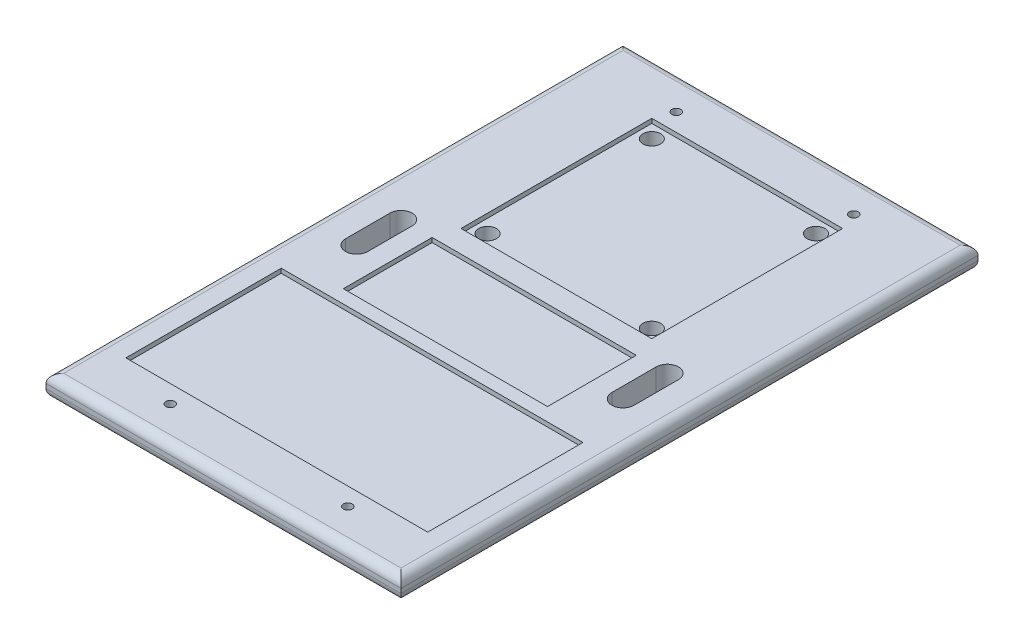
from build123d import *

# Parameters (mm, degrees)
SKETCH2_W               = 80
SKETCH2_H               = 130
BOSS_EXTRUDE1_DEPTH     = 3
SKETCH3_W               = 80
SKETCH3_H               = 130
BOSS_EXTRUDE2_DEPTH     = 2
FILLET1_R               = 2
CUT_EXTRUDE1_DEPTH      = 153.672852859
CUT_EXTRUDE1_DEPTH_BACK = 153.672852859
SKETCH6_R               = 1
CUT_EXTRUDE2_DEPTH      = 3
SKETCH6_3_W             = 68
SKETCH6_3_H             = 35
SKETCH6_3_W_2           = 43
SKETCH6_3_H_2           = 43
SKETCH6_3_R             = 2
SKETCH6_3_W_3           = 46
SKETCH6_3_H_3           = 20
CUT_EXTRUDE3_DEPTH      = 1
SKETCH6_4_R             = 2
CUT_EXTRUDE4_DEPTH      = 153.725243493


with BuildPart() as part:
    # Sketch2 → Boss-Extrude1 (new body)
    with BuildSketch(Plane(origin=(0, 0, 0), x_dir=(1, 0, 0), z_dir=(0, 1, 0))):
        with Locations((-40, 65)):
            Rectangle(SKETCH2_W, SKETCH2_H)
        with BuildLine():
            Line((-4, 28), (-4, 8))
            ThreePointArc((-4, 8), (-8, 4), (-12, 8))
            Line((-12, 8), (-12, 28))
            ThreePointArc((-12, 28), (-8, 32), (-4, 28))
        make_face(mode=Mode.SUBTRACT)
        with BuildLine():
            Line((-4, 102), (-4, 122))
            ThreePointArc((-4, 122), (-8, 126), (-12, 122))
            Line((-12, 122), (-12, 102))
            ThreePointArc((-12, 102), (-8, 98), (-4, 102))
        make_face(mode=Mode.SUBTRACT)
        with BuildLine():
            Line((-76, 102), (-76, 122))
            ThreePointArc((-76, 122), (-72, 126), (-68, 122))
            Line((-68, 122), (-68, 102))
            ThreePointArc((-68, 102), (-72, 98), (-76, 102))
        make_face(mode=Mode.SUBTRACT)
        with BuildLine():
            Line((-76, 28), (-76, 8))
            ThreePointArc((-76, 8), (-72, 4), (-68, 8))
            Line((-68, 8), (-68, 28))
            ThreePointArc((-68, 28), (-72, 32), (-76, 28))
        make_face(mode=Mode.SUBTRACT)
    extrude(amount=-BOSS_EXTRUDE1_DEPTH)

    # Sketch3 → Boss-Extrude2 (add)
    with BuildSketch(Plane(origin=(0, 0, 0), x_dir=(1, 0, 0), z_dir=(0, 1, 0))):
        with Locations((-40, 65)):
            Rectangle(SKETCH3_W, SKETCH3_H)
    extrude(amount=BOSS_EXTRUDE2_DEPTH)

    # Fillet1
    fillet1_edges = [part.edges().sort_by_distance(p)[0] for p in [
        (-40, -3, -130),
        (-40, 2, -130),
        (-80, -3, -65),
        (-80, 2, -65),
        (0, 2, -65),
        (0, -3, -65),
        (-40, -3, 0),
        (-40, 2, 0),
    ]]
    fillet(fillet1_edges, radius=FILLET1_R)

    # Sketch4 → Cut-Extrude1 (cut, two sides: drawn at the far end of the back side and taken through both)
    with BuildSketch(Plane(origin=(0, 0, 0), x_dir=(1, 0, 0), z_dir=(0, 1, 0)).offset(-CUT_EXTRUDE1_DEPTH_BACK)):
        with BuildLine():
            Line((-7.5, 70), (-7.5, 60))
            ThreePointArc((-7.5, 60), (-10, 57.5), (-12.5, 60))
            Line((-12.5, 60), (-12.5, 70))
            ThreePointArc((-12.5, 70), (-10, 72.5), (-7.5, 70))
        make_face()
        with BuildLine():
            Line((-72.5, 70), (-72.5, 60))
            ThreePointArc((-72.5, 60), (-70, 57.5), (-67.5, 60))
            Line((-67.5, 60), (-67.5, 70))
            ThreePointArc((-67.5, 70), (-70, 72.5), (-72.5, 70))
        make_face()
    extrude(amount=CUT_EXTRUDE1_DEPTH + CUT_EXTRUDE1_DEPTH_BACK, mode=Mode.SUBTRACT)

    # Sketch6 → Cut-Extrude2 (cut)
    with BuildSketch(Plane(origin=(0, 2, 0), x_dir=(1, 0, 0), z_dir=(0, 1, 0))):
        with Locations((-60, 122)):
            Circle(SKETCH6_R)
        with Locations((-20, 122)):
            Circle(SKETCH6_R)
        with Locations((-20, 8)):
            Circle(SKETCH6_R)
        with Locations((-60, 8)):
            Circle(SKETCH6_R)
    extrude(amount=-CUT_EXTRUDE2_DEPTH, mode=Mode.SUBTRACT)

    # Sketch6<3> → Cut-Extrude3 (cut)
    # profile 1 of 3: a face of its own
    with BuildSketch(Plane(origin=(0, 2, 0), x_dir=(1, 0, 0), z_dir=(0, 1, 0))):
        with Locations((-40, 29.5)):
            Rectangle(SKETCH6_3_W, SKETCH6_3_H)
    # profile 2 of 3: a face of its own
    with BuildSketch(Plane(origin=(0, 2, 0), x_dir=(1, 0, 0), z_dir=(0, 1, 0))):
        with Locations((-40, 96.5)):
            Rectangle(SKETCH6_3_W_2, SKETCH6_3_H_2)
        with Locations((-58.5, 78)):
            Circle(SKETCH6_3_R, mode=Mode.SUBTRACT)
        with Locations((-58.5, 115)):
            Circle(SKETCH6_3_R, mode=Mode.SUBTRACT)
        with Locations((-21.5, 78)):
            Circle(SKETCH6_3_R, mode=Mode.SUBTRACT)
        with Locations((-21.5, 115)):
            Circle(SKETCH6_3_R, mode=Mode.SUBTRACT)
    # profile 3 of 3: a face of its own
    with BuildSketch(Plane(origin=(0, 2, 0), x_dir=(1, 0, 0), z_dir=(0, 1, 0))):
        with Locations((-40, 60)):
            Rectangle(SKETCH6_3_W_3, SKETCH6_3_H_3)
    extrude(amount=-CUT_EXTRUDE3_DEPTH, mode=Mode.SUBTRACT)

    # Sketch6<4> → Cut-Extrude4 (cut, through all)
    with BuildSketch(Plane(origin=(0, 2, 0), x_dir=(1, 0, 0), z_dir=(0, 1, 0))):
        with Locations((-21.5, 115)):
            Circle(SKETCH6_4_R)
        with Locations((-21.5, 78)):
            Circle(SKETCH6_4_R)
        with Locations((-58.5, 78)):
            Circle(SKETCH6_4_R)
        with Locations((-58.5, 115)):
            Circle(SKETCH6_4_R)
    extrude(amount=-CUT_EXTRUDE4_DEPTH, mode=Mode.SUBTRACT)


solid = part.part
